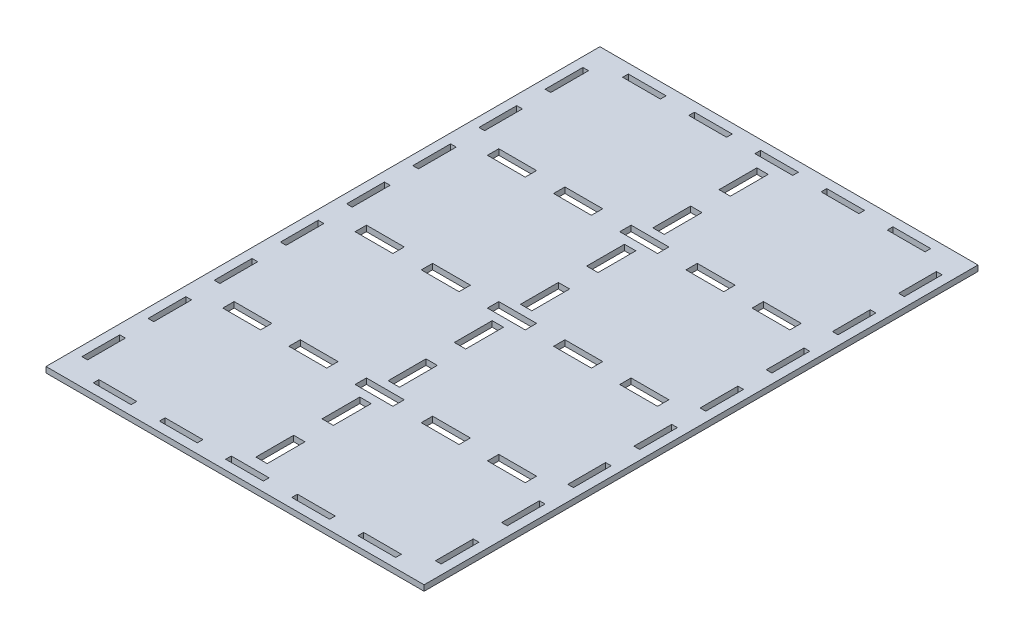
from build123d import *

# Parameters (mm, degrees)
SKETCH1_W             = 200
SKETCH1_H             = 293
SKETCH1_W_2           = 20
SKETCH1_H_2           = 3
SKETCH1_W_3           = 3
SKETCH1_H_3           = 20
BOSS_EXTRUDE1_DEPTH   = 3
SKETCH2_W             = 20
SKETCH2_H             = 3
SKETCH2_W_2           = 3
SKETCH2_H_2           = 20
CUT_EXTRUDE2_DEPTH    = 10
LPATTERN3_START       = 55
LPATTERN3_OUTLINE_W   = 3
LPATTERN3_OUTLINE_H   = 3
LPATTERN3_DEPTH       = 20
LPATTERN3_START_2     = 90
LPATTERN3_2_OUTLINE_W = 3
LPATTERN3_2_OUTLINE_H = 3
LPATTERN3_2_DEPTH     = 20
LPATTERN3_START_3     = 125
LPATTERN3_3_OUTLINE_W = 3
LPATTERN3_3_OUTLINE_H = 3
LPATTERN3_3_DEPTH     = 20
LPATTERN3_START_4     = 160
LPATTERN3_4_OUTLINE_W = 3
LPATTERN3_4_OUTLINE_H = 3
LPATTERN3_4_DEPTH     = 20
LPATTERN3_START_5     = 20
LPATTERN3_5_OUTLINE_W = 3
LPATTERN3_5_OUTLINE_H = 3
LPATTERN3_5_DEPTH     = 20
LPATTERN4_START       = -244
LPATTERN4_OUTLINE_W   = 3
LPATTERN4_OUTLINE_H   = 3
LPATTERN4_DEPTH       = 20
LPATTERN4_START_2     = -209
LPATTERN4_2_OUTLINE_W = 3
LPATTERN4_2_OUTLINE_H = 3
LPATTERN4_2_DEPTH     = 20
LPATTERN4_START_3     = -174
LPATTERN4_3_OUTLINE_W = 3
LPATTERN4_3_OUTLINE_H = 3
LPATTERN4_3_DEPTH     = 20
LPATTERN4_START_4     = -139
LPATTERN4_4_OUTLINE_W = 3
LPATTERN4_4_OUTLINE_H = 3
LPATTERN4_4_DEPTH     = 20
LPATTERN4_START_5     = -104
LPATTERN4_5_OUTLINE_W = 3
LPATTERN4_5_OUTLINE_H = 3
LPATTERN4_5_DEPTH     = 20
LPATTERN4_START_6     = -69
LPATTERN4_6_OUTLINE_W = 3
LPATTERN4_6_OUTLINE_H = 3
LPATTERN4_6_DEPTH     = 20
LPATTERN4_START_7     = -34
LPATTERN4_7_OUTLINE_W = 3
LPATTERN4_7_OUTLINE_H = 3
LPATTERN4_7_DEPTH     = 20
LPATTERN4_START_8     = -279
LPATTERN4_8_OUTLINE_W = 3
LPATTERN4_8_OUTLINE_H = 3
LPATTERN4_8_DEPTH     = 20
SKETCH4_W             = 20
SKETCH4_H             = 6
CUT_EXTRUDE3_DEPTH    = 10
LPATTERN5_COUNT       = 5
LPATTERN5_PITCH       = 35
LPATTERN5_COUNT_DIR2  = 3
LPATTERN5_PITCH_DIR2  = 70
SKETCH5_W             = 6
SKETCH5_H             = 20
CUT_EXTRUDE4_DEPTH    = 10
LPATTERN6_COUNT       = 8
LPATTERN6_PITCH       = 35


# Read off the part's stored shape, not the designer's step: LPattern3, LPattern4
with BuildPart() as part:
    # Sketch1 → Boss-Extrude1 (new body)
    # profile 1 of 3: a face of its own
    with BuildSketch(Plane(origin=(0, 0, 0), x_dir=(1, 0, 0), z_dir=(0, 1, 0))):
        with Locations((100, 146.5)):
            Rectangle(SKETCH1_W, SKETCH1_H)
        with Locations((30, 286.5)):
            Rectangle(SKETCH1_W_2, SKETCH1_H_2, mode=Mode.SUBTRACT)
        with Locations((6.5, 269)):
            Rectangle(SKETCH1_W_3, SKETCH1_H_3, mode=Mode.SUBTRACT)
    # profile 2 of 3: a face of its own
    with BuildSketch(Plane(origin=(0, 0, 0), x_dir=(1, 0, 0), z_dir=(0, 1, 0))):
        with Locations((30, 286.5)):
            Rectangle(SKETCH1_W_2, SKETCH1_H_2)
    # profile 3 of 3: a face of its own
    with BuildSketch(Plane(origin=(0, 0, 0), x_dir=(1, 0, 0), z_dir=(0, 1, 0))):
        with Locations((6.5, 269)):
            Rectangle(SKETCH1_W_3, SKETCH1_H_3)
    extrude(amount=BOSS_EXTRUDE1_DEPTH)

    # Sketch2 → Cut-Extrude2 (cut)
    with BuildSketch(Plane(origin=(0, 3, 0), x_dir=(1, 0, 0), z_dir=(0, 1, 0))):
        with Locations((30, 286.5)):
            Rectangle(SKETCH2_W, SKETCH2_H)
        with Locations((6.5, 269)):
            Rectangle(SKETCH2_W_2, SKETCH2_H_2)
    extrude(amount=-CUT_EXTRUDE2_DEPTH, mode=Mode.SUBTRACT)

    # LPattern3 outline → LPattern3 (cut)
    with BuildSketch(Plane.YZ.offset(LPATTERN3_START)):
        with Locations((1.5, -6.5)):
            Rectangle(LPATTERN3_OUTLINE_W, LPATTERN3_OUTLINE_H)
        with Locations((1.5, -76.5)):
            Rectangle(LPATTERN3_OUTLINE_W, LPATTERN3_OUTLINE_H)
        with Locations((1.5, -146.5)):
            Rectangle(LPATTERN3_OUTLINE_W, LPATTERN3_OUTLINE_H)
        with Locations((1.5, -216.5)):
            Rectangle(LPATTERN3_OUTLINE_W, LPATTERN3_OUTLINE_H)
        with Locations((1.5, -286.5)):
            Rectangle(LPATTERN3_OUTLINE_W, LPATTERN3_OUTLINE_H)
    extrude(amount=LPATTERN3_DEPTH, mode=Mode.SUBTRACT)

    # LPattern3 2 outline → LPattern3 2 (cut)
    with BuildSketch(Plane.YZ.offset(LPATTERN3_START_2)):
        with Locations((1.5, -6.5)):
            Rectangle(LPATTERN3_2_OUTLINE_W, LPATTERN3_2_OUTLINE_H)
        with Locations((1.5, -76.5)):
            Rectangle(LPATTERN3_2_OUTLINE_W, LPATTERN3_2_OUTLINE_H)
        with Locations((1.5, -146.5)):
            Rectangle(LPATTERN3_2_OUTLINE_W, LPATTERN3_2_OUTLINE_H)
        with Locations((1.5, -216.5)):
            Rectangle(LPATTERN3_2_OUTLINE_W, LPATTERN3_2_OUTLINE_H)
        with Locations((1.5, -286.5)):
            Rectangle(LPATTERN3_2_OUTLINE_W, LPATTERN3_2_OUTLINE_H)
    extrude(amount=LPATTERN3_2_DEPTH, mode=Mode.SUBTRACT)

    # LPattern3 3 outline → LPattern3 3 (cut)
    with BuildSketch(Plane.YZ.offset(LPATTERN3_START_3)):
        with Locations((1.5, -6.5)):
            Rectangle(LPATTERN3_3_OUTLINE_W, LPATTERN3_3_OUTLINE_H)
        with Locations((1.5, -76.5)):
            Rectangle(LPATTERN3_3_OUTLINE_W, LPATTERN3_3_OUTLINE_H)
        with Locations((1.5, -146.5)):
            Rectangle(LPATTERN3_3_OUTLINE_W, LPATTERN3_3_OUTLINE_H)
        with Locations((1.5, -216.5)):
            Rectangle(LPATTERN3_3_OUTLINE_W, LPATTERN3_3_OUTLINE_H)
        with Locations((1.5, -286.5)):
            Rectangle(LPATTERN3_3_OUTLINE_W, LPATTERN3_3_OUTLINE_H)
    extrude(amount=LPATTERN3_3_DEPTH, mode=Mode.SUBTRACT)

    # LPattern3 4 outline → LPattern3 4 (cut)
    with BuildSketch(Plane.YZ.offset(LPATTERN3_START_4)):
        with Locations((1.5, -6.5)):
            Rectangle(LPATTERN3_4_OUTLINE_W, LPATTERN3_4_OUTLINE_H)
        with Locations((1.5, -76.5)):
            Rectangle(LPATTERN3_4_OUTLINE_W, LPATTERN3_4_OUTLINE_H)
        with Locations((1.5, -146.5)):
            Rectangle(LPATTERN3_4_OUTLINE_W, LPATTERN3_4_OUTLINE_H)
        with Locations((1.5, -216.5)):
            Rectangle(LPATTERN3_4_OUTLINE_W, LPATTERN3_4_OUTLINE_H)
        with Locations((1.5, -286.5)):
            Rectangle(LPATTERN3_4_OUTLINE_W, LPATTERN3_4_OUTLINE_H)
    extrude(amount=LPATTERN3_4_DEPTH, mode=Mode.SUBTRACT)

    # LPattern3 5 outline → LPattern3 5 (cut)
    with BuildSketch(Plane.YZ.offset(LPATTERN3_START_5)):
        with Locations((1.5, -6.5)):
            Rectangle(LPATTERN3_5_OUTLINE_W, LPATTERN3_5_OUTLINE_H)
        with Locations((1.5, -76.5)):
            Rectangle(LPATTERN3_5_OUTLINE_W, LPATTERN3_5_OUTLINE_H)
        with Locations((1.5, -146.5)):
            Rectangle(LPATTERN3_5_OUTLINE_W, LPATTERN3_5_OUTLINE_H)
        with Locations((1.5, -216.5)):
            Rectangle(LPATTERN3_5_OUTLINE_W, LPATTERN3_5_OUTLINE_H)
    extrude(amount=LPATTERN3_5_DEPTH, mode=Mode.SUBTRACT)

    # LPattern4 outline → LPattern4 (cut)
    with BuildSketch(Plane.XY.offset(LPATTERN4_START)):
        with Locations((193.5, 1.5)):
            Rectangle(LPATTERN4_OUTLINE_W, LPATTERN4_OUTLINE_H)
        with Locations((100, 1.5)):
            Rectangle(LPATTERN4_OUTLINE_W, LPATTERN4_OUTLINE_H)
        with Locations((6.5, 1.5)):
            Rectangle(LPATTERN4_OUTLINE_W, LPATTERN4_OUTLINE_H)
    extrude(amount=LPATTERN4_DEPTH, mode=Mode.SUBTRACT)

    # LPattern4 2 outline → LPattern4 2 (cut)
    with BuildSketch(Plane.XY.offset(LPATTERN4_START_2)):
        with Locations((193.5, 1.5)):
            Rectangle(LPATTERN4_2_OUTLINE_W, LPATTERN4_2_OUTLINE_H)
        with Locations((100, 1.5)):
            Rectangle(LPATTERN4_2_OUTLINE_W, LPATTERN4_2_OUTLINE_H)
        with Locations((6.5, 1.5)):
            Rectangle(LPATTERN4_2_OUTLINE_W, LPATTERN4_2_OUTLINE_H)
    extrude(amount=LPATTERN4_2_DEPTH, mode=Mode.SUBTRACT)

    # LPattern4 3 outline → LPattern4 3 (cut)
    with BuildSketch(Plane.XY.offset(LPATTERN4_START_3)):
        with Locations((193.5, 1.5)):
            Rectangle(LPATTERN4_3_OUTLINE_W, LPATTERN4_3_OUTLINE_H)
        with Locations((100, 1.5)):
            Rectangle(LPATTERN4_3_OUTLINE_W, LPATTERN4_3_OUTLINE_H)
        with Locations((6.5, 1.5)):
            Rectangle(LPATTERN4_3_OUTLINE_W, LPATTERN4_3_OUTLINE_H)
    extrude(amount=LPATTERN4_3_DEPTH, mode=Mode.SUBTRACT)

    # LPattern4 4 outline → LPattern4 4 (cut)
    with BuildSketch(Plane.XY.offset(LPATTERN4_START_4)):
        with Locations((193.5, 1.5)):
            Rectangle(LPATTERN4_4_OUTLINE_W, LPATTERN4_4_OUTLINE_H)
        with Locations((100, 1.5)):
            Rectangle(LPATTERN4_4_OUTLINE_W, LPATTERN4_4_OUTLINE_H)
        with Locations((6.5, 1.5)):
            Rectangle(LPATTERN4_4_OUTLINE_W, LPATTERN4_4_OUTLINE_H)
    extrude(amount=LPATTERN4_4_DEPTH, mode=Mode.SUBTRACT)

    # LPattern4 5 outline → LPattern4 5 (cut)
    with BuildSketch(Plane.XY.offset(LPATTERN4_START_5)):
        with Locations((193.5, 1.5)):
            Rectangle(LPATTERN4_5_OUTLINE_W, LPATTERN4_5_OUTLINE_H)
        with Locations((100, 1.5)):
            Rectangle(LPATTERN4_5_OUTLINE_W, LPATTERN4_5_OUTLINE_H)
        with Locations((6.5, 1.5)):
            Rectangle(LPATTERN4_5_OUTLINE_W, LPATTERN4_5_OUTLINE_H)
    extrude(amount=LPATTERN4_5_DEPTH, mode=Mode.SUBTRACT)

    # LPattern4 6 outline → LPattern4 6 (cut)
    with BuildSketch(Plane.XY.offset(LPATTERN4_START_6)):
        with Locations((193.5, 1.5)):
            Rectangle(LPATTERN4_6_OUTLINE_W, LPATTERN4_6_OUTLINE_H)
        with Locations((100, 1.5)):
            Rectangle(LPATTERN4_6_OUTLINE_W, LPATTERN4_6_OUTLINE_H)
        with Locations((6.5, 1.5)):
            Rectangle(LPATTERN4_6_OUTLINE_W, LPATTERN4_6_OUTLINE_H)
    extrude(amount=LPATTERN4_6_DEPTH, mode=Mode.SUBTRACT)

    # LPattern4 7 outline → LPattern4 7 (cut)
    with BuildSketch(Plane.XY.offset(LPATTERN4_START_7)):
        with Locations((193.5, 1.5)):
            Rectangle(LPATTERN4_7_OUTLINE_W, LPATTERN4_7_OUTLINE_H)
        with Locations((100, 1.5)):
            Rectangle(LPATTERN4_7_OUTLINE_W, LPATTERN4_7_OUTLINE_H)
        with Locations((6.5, 1.5)):
            Rectangle(LPATTERN4_7_OUTLINE_W, LPATTERN4_7_OUTLINE_H)
    extrude(amount=LPATTERN4_7_DEPTH, mode=Mode.SUBTRACT)

    # LPattern4 8 outline → LPattern4 8 (cut)
    with BuildSketch(Plane.XY.offset(LPATTERN4_START_8)):
        with Locations((193.5, 1.5)):
            Rectangle(LPATTERN4_8_OUTLINE_W, LPATTERN4_8_OUTLINE_H)
        with Locations((100, 1.5)):
            Rectangle(LPATTERN4_8_OUTLINE_W, LPATTERN4_8_OUTLINE_H)
    extrude(amount=LPATTERN4_8_DEPTH, mode=Mode.SUBTRACT)

    # Sketch4 → Cut-Extrude3 (cut)
    with BuildSketch(Plane(origin=(0, 3, 0), x_dir=(1, 0, 0), z_dir=(0, 1, 0))):
        with Locations((30, 216.5)):
            Rectangle(SKETCH4_W, SKETCH4_H)
    cut_extrude3 = extrude(amount=-CUT_EXTRUDE3_DEPTH, mode=Mode.SUBTRACT)

    # LPattern5: Cut-Extrude3 5 × 3
    with Locations(*[(i * LPATTERN5_PITCH, 0, j * LPATTERN5_PITCH_DIR2) for i in range(LPATTERN5_COUNT) for j in range(LPATTERN5_COUNT_DIR2) if (i, j) != (0, 0)]):
        add(cut_extrude3, mode=Mode.SUBTRACT)

    # Sketch5 → Cut-Extrude4 (cut)
    with BuildSketch(Plane(origin=(0, 3, 0), x_dir=(1, 0, 0), z_dir=(0, 1, 0))):
        with Locations((100, 269)):
            Rectangle(SKETCH5_W, SKETCH5_H)
    cut_extrude4 = extrude(amount=-CUT_EXTRUDE4_DEPTH, mode=Mode.SUBTRACT)

    # LPattern6: Cut-Extrude4 ×8
    with Locations(*[(0, 0, i * LPATTERN6_PITCH) for i in range(1, LPATTERN6_COUNT)]):
        add(cut_extrude4, mode=Mode.SUBTRACT)


solid = part.part
